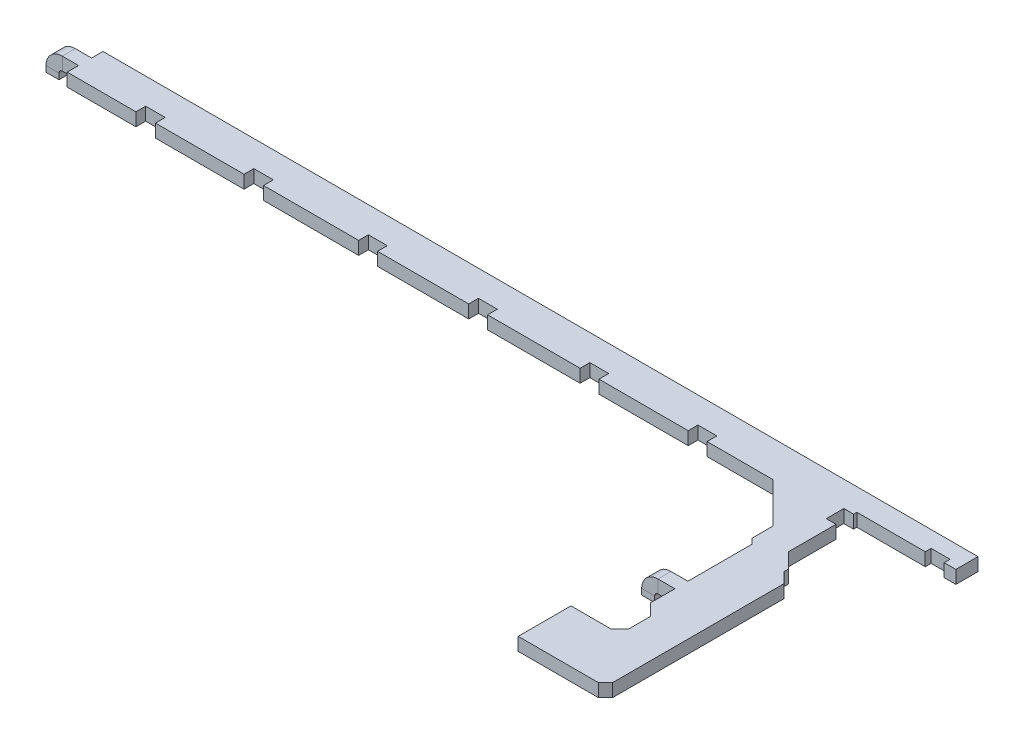
from build123d import *

# Parameters (mm, degrees)
BOSS_EXTRUDE1_DEPTH     = 2
EDGE_FLANGE1_DEPTH      = 2
EDGE_FLANGE1_BEND_DEPTH = 2
MOVE_FACE1_BY           = 5
CUT_EXTRUDE1_DEPTH      = 10


# Sheet-metal steps are written as plain solids
with BuildPart() as part:
    # Sketch1 → Boss-Extrude1 (new body)
    with BuildSketch(Plane(origin=(0, 0, 0), x_dir=(1, 0, 0), z_dir=(0, 1, 0))):
        Polygon((48.786990623, -23.171897133), (48.786990623, -13.328634875), (47.986992223, -12.528636475), (47.986992223, -9.428635055), (41.786991923, -3.228634755), (-54.913007717, -3.228634755), (-66.471417942, -3.228634755), (-66.471417942, -1.378635375), (-68.471417942, -1.378635375), (-68.471417942, 0.621364625), (-66.471417942, 0.621364625), (-66.471417942, 2.471364005), (-54.913007717, 2.471364005), (65.786992183, 2.471364005), (65.786992183, -1.128636415), (52.786992783, -1.128636415), (52.786992783, -11.528635935), (54.986990923, -13.728634075), (54.986993463, -14.428635215), (56.686992603, -16.128634355), (56.686992603, -42.528634895), (53.786993323, -45.428634175), (43.086991863, -45.428634175), (43.086991863, -34.028634115), (49.286992163, -34.028634115), (50.586992103, -32.728634175), (50.586992103, -30.828635435), (48.786990623, -29.028636495), (48.786990623, -25.171897133), (46.786990623, -25.171897133), (46.786990623, -23.171897133), align=None)
    extrude(amount=BOSS_EXTRUDE1_DEPTH)

    # Edge-Flange1 section (across the edge) → Edge-Flange1 (add)
    with BuildSketch(Plane(origin=(-69.471417942, 0, 1.378635375), x_dir=(1, 0, 0), z_dir=(0, 0, -1))):
        with BuildLine():
            Line((-2, 0.5), (-2, 1.4))
            Line((-2, 1.4), (0, 1.4))
            Line((0, 1.4), (0, 0.5))
            ThreePointArc((0, 0.5), (0.146446609, 0.146446609), (0.5, 0))
            Line((0.5, 0), (1, 0))
            Line((1, 0), (1, -2))
            Line((1, -2), (0.5, -2))
            ThreePointArc((0.5, -2), (-1.267766953, -1.267766953), (-2, 0.5))
        make_face()
    extrude(amount=EDGE_FLANGE1_DEPTH)

    # Edge-Flange1 section 2 (across the edge) → Edge-Flange1 bend (add)
    with BuildSketch(Plane(origin=(45.786990623, 0, 25.171897133), x_dir=(1, 0, 0), z_dir=(0, 0, -1))):
        with BuildLine():
            Line((-2, 0.5), (-2, 1.4))
            Line((-2, 1.4), (0, 1.4))
            Line((0, 1.4), (0, 0.5))
            ThreePointArc((0, 0.5), (0.146446609, 0.146446609), (0.5, 0))
            Line((0.5, 0), (1, 0))
            Line((1, 0), (1, -2))
            Line((1, -2), (0.5, -2))
            ThreePointArc((0.5, -2), (-1.267766953, -1.267766953), (-2, 0.5))
        make_face()
    extrude(amount=EDGE_FLANGE1_BEND_DEPTH)

    # Move Face1: a face moved outward by 5.0
    extrude(part.faces().sort_by_distance((65.786992183, 1, -0.671363795))[0], amount=MOVE_FACE1_BY, dir=(1, 0, 0))

    # Sketch12 → Cut-Extrude1 (cut)
    with BuildSketch(Plane(origin=(0, 2, 0), x_dir=(1, 0, 0), z_dir=(0, 1, 0))):
        Polygon((-52.913012042, -1.628639718), (-55.913012042, -1.628639718), (-55.913012042, -3.128639258), (-67.564249917, -3.128639258), (-67.671952829, -4.327104706), (41.886988858, -5.326407077), (48.086989158, -13.828640718), (48.007739716, -22.517187069), (46.286990623, -23.171897133), (48.886987558, -23.171897133), (48.886987558, -13.328639178), (48.086989158, -12.528640778), (48.086989158, -9.328639558), (41.886988858, -3.128639258), (31.786988738, -3.128639258), (31.786988738, -1.628639718), (28.886989458, -1.628639718), (28.886989458, -3.128639258), (15.186988918, -3.128639258), (15.186988918, -1.628639718), (12.286989638, -1.628639718), (12.286989638, -3.128639258), (-1.913012442, -3.128639258), (-1.913012442, -1.628639718), (-4.813011722, -1.628639718), (-4.813011722, -3.128639258), (-18.813011662, -3.128639258), (-18.813011662, -1.628639718), (-21.713010942, -1.628639718), (-21.713010942, -3.128639258), (-36.313012222, -3.128639258), (-36.313012222, -1.628639718), (-39.313011302, -1.628639718), (-39.313011302, -3.128639258), (-52.913012042, -3.128639258), align=None)
        Polygon((48.886987558, -25.171897133), (46.286990623, -25.171897133), (41.570815933, -34.028638418), (41.570815933, -47.167587605), (56.254650903, -46.954291818), (57.278434149, -42.02008581), (58.126913923, -16.761088184), (54.30540669, -8.580570975), (54.30540669, -2.3223377), (71.613193797, -2.589733287), (71.946410025, 3.760976012), (44.354427072, 3.760976012), (-68.474759816, 3.760976012), (-68.386329283, 2.371359902), (67.886988718, 2.371359902), (67.886988718, -1.028638378), (66.086988718, -1.028638378), (66.086988718, -0.128640178), (63.186989438, -0.128640178), (63.186989438, -1.028638378), (52.686987578, -1.028638378), (52.686987578, -1.528639918), (51.186988038, -1.528639918), (51.186988038, -4.228639598), (52.686987578, -4.228639598), (52.686987578, -11.528640238), (54.986988058, -13.828640718), (54.986988058, -14.528639318), (56.586989938, -16.128641198), (56.586989938, -42.428636858), (55.486987058, -43.528639738), (43.186988798, -43.528639738), (43.186988798, -35.428640698), (49.286986758, -35.428640698), (50.686989038, -34.028638418), (50.686989038, -30.728637398), (48.886987558, -28.928638458), align=None)
    extrude(amount=-CUT_EXTRUDE1_DEPTH, mode=Mode.SUBTRACT)


solid = part.part
